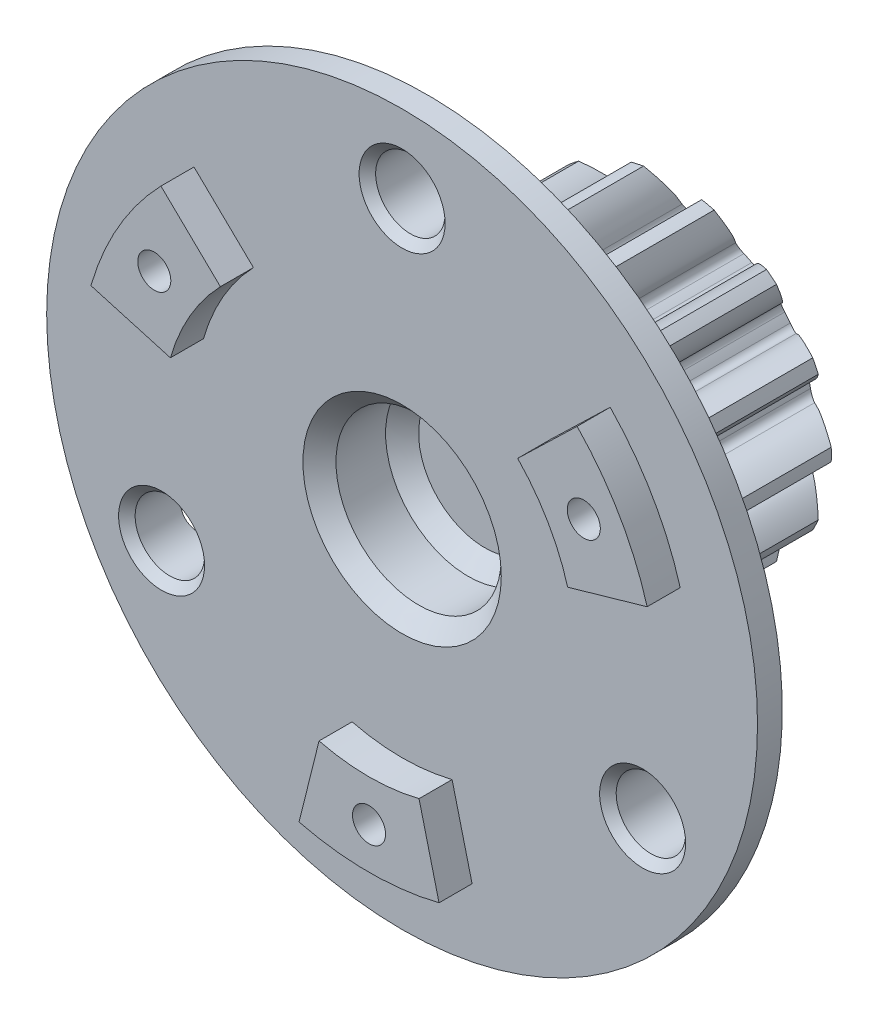
from build123d import *

# Parameters (mm, degrees)
SKETCH1_R                    = 9.6
LASHENA_DEPTH                = 15
CUT_EXTRUDEA_DEPTH           = 15
WWW_KYTOOL_CN_COUNT          = 14
SKETCH3_R                    = 21.5
BOSS_EXTRUDE2_DEPTH          = 3.5
SKETCH4_R                    = 2.1
CUT_EXTRUDE2_DEPTH           = 34.904277187
CHAMFER1_SIZE                = 0.5
CIRPATTERN2_COUNT            = 3
CHAMFER1_OF_CIRPATTERN2_SIZE = 0.5
SKETCH5_R                    = 21.5
SKETCH5_R_2                  = 19.5
CUT_EXTRUDE3_DEPTH           = 2
BOSS_EXTRUDE3_DEPTH          = 2
SKETCH7_R                    = 1
CUT_EXTRUDE4_DEPTH           = 37.670833153
CIRPATTERN3_COUNT            = 3
CHAMFER2_SIZE                = 1
SKETCH9_R                    = 5
CUT_EXTRUDE5_DEPTH           = 5
CHAMFER3_SIZE                = 1
CHAMFER4_SIZE                = 1


with BuildPart() as part:
    # Sketch1 → LaShenA (new body)
    with BuildSketch(Plane.XY):
        Circle(SKETCH1_R)
    extrude(amount=LASHENA_DEPTH)

    # SketchA → Cut-ExtrudeA (cut)
    with BuildSketch(Plane.XY.offset(15)):
        with BuildLine():
            ThreePointArc((0.26393016, 6.894950389), (0, 6.9), (-0.26393016, 6.894950389))
            ThreePointArc((-0.26393016, 6.894950389), (-0.579770413, 7.005805588), (-0.734822357, 7.302458305))
            add(Edge.make_bspline(
                [(-0.734822357, 7.302458305), (-0.754433399, 7.487112064), (-0.737569189, 7.703882298), (-0.781720243, 7.928445907), (-0.797392974, 7.985498549), (-0.811085013, 8.030575138), (-0.828493419, 8.082070174), (-0.849959168, 8.139814633), (-0.875893686, 8.203596808), (-0.906673874, 8.273194995), (-0.942675165, 8.348367366), (-0.984260087, 8.428855678), (-1.031780916, 8.514384646), (-1.085577958, 8.604662703), (-1.145979199, 8.699382364), (-1.213299565, 8.798220744), (-1.287840319, 8.90084006), (-1.369888442, 9.006888177), (-1.459716048, 9.11599916), (-1.557579813, 9.227793861), (-1.663720428, 9.341880521), (-1.778362068, 9.457855399), (-1.90171193, 9.575303407), (-2.033959602, 9.693798799), (-2.226077653, 9.855722018), (-2.3785632, 9.972613701), (-2.48435509, 10.048922054)],
                knots=[0.117633248, 0.117633248, 0.117633248, 0.117633248, 0.261739633, 0.285267442, 0.295625886, 0.307867683, 0.321992833, 0.338001336, 0.355893192, 0.375668402, 0.397326964, 0.42086888, 0.446294149, 0.473602771, 0.502794746, 0.533870075, 0.566828756, 0.601670791, 0.638396179, 0.677004921, 0.717497015, 0.759872463, 0.804131264, 0.850273418, 0.898298926, 1, 1, 1, 1], degree=3))
            ThreePointArc((-2.48435509, 10.048922054), (0, 10.351466304), (2.48435509, 10.048922054))
            add(Edge.make_bspline(
                [(0.734822357, 7.302458305), (0.754433399, 7.487112064), (0.737569189, 7.703882298), (0.781720243, 7.928445907), (0.797392974, 7.985498549), (0.811085013, 8.030575138), (0.828493419, 8.082070174), (0.849959168, 8.139814633), (0.875893686, 8.203596808), (0.906673874, 8.273194995), (0.942675165, 8.348367366), (0.984260087, 8.428855678), (1.031780916, 8.514384646), (1.085577958, 8.604662703), (1.145979199, 8.699382364), (1.213299565, 8.798220744), (1.287840319, 8.90084006), (1.369888442, 9.006888177), (1.459716048, 9.11599916), (1.557579813, 9.227793861), (1.663720428, 9.341880521), (1.778362068, 9.457855399), (1.90171193, 9.575303407), (2.033959602, 9.693798799), (2.226077653, 9.855722018), (2.3785632, 9.972613701), (2.48435509, 10.048922054)],
                knots=[0.117633248, 0.117633248, 0.117633248, 0.117633248, 0.261739633, 0.285267442, 0.295625886, 0.307867683, 0.321992833, 0.338001336, 0.355893192, 0.375668402, 0.397326964, 0.42086888, 0.446294149, 0.473602771, 0.502794746, 0.533870075, 0.566828756, 0.601670791, 0.638396179, 0.677004921, 0.717497015, 0.759872463, 0.804131264, 0.850273418, 0.898298926, 1, 1, 1, 1], degree=3))
            ThreePointArc((0.734822357, 7.302458305), (0.579770413, 7.005805588), (0.26393016, 6.894950389))
        make_face()
    cut_extrudea = extrude(amount=-CUT_EXTRUDEA_DEPTH, mode=Mode.SUBTRACT)

    # www.KYTool.cn: Cut-ExtrudeA ×14 about axis
    www_kytool_cn_axis = Axis((0, 0, -88.99), (0, 0, 1))
    for i in range(1, WWW_KYTOOL_CN_COUNT):
        add(cut_extrudea.rotate(www_kytool_cn_axis, i * 360 / WWW_KYTOOL_CN_COUNT), mode=Mode.SUBTRACT)

    # Sketch3 → Boss-Extrude2 (add)
    with BuildSketch(Plane.XY.offset(15)):
        Circle(SKETCH3_R)
    extrude(amount=BOSS_EXTRUDE2_DEPTH)

    # Sketch4 → Cut-Extrude2 (cut, through all)
    with BuildSketch(Plane(origin=(0, 0, 15), x_dir=(-1, 0, 0), z_dir=(0, 0, -1))):
        with Locations((0, 16.8)):
            Circle(SKETCH4_R)
    cut_extrude2 = extrude(amount=-CUT_EXTRUDE2_DEPTH, mode=Mode.SUBTRACT)

    # Chamfer1
    chamfer1_edges = [part.edges().sort_by_distance(p)[0] for p in [
        (2.1, 16.8, 18.5),
    ]]
    chamfer(chamfer1_edges, length=CHAMFER1_SIZE)

    # CirPattern2: Cut-Extrude2 ×3 about axis
    cirpattern2_axis = Axis((0, 0, 0), (0, 0, 1))
    for i in range(1, CIRPATTERN2_COUNT):
        add(cut_extrude2.rotate(cirpattern2_axis, i * 360 / CIRPATTERN2_COUNT), mode=Mode.SUBTRACT)

    # Chamfer1 of CirPattern2
    chamfer1_of_cirpattern2_edges = [part.edges().sort_by_distance(p)[0] for p in [
        (-15.599226784, -6.581346652, 18.5),
        (13.499226784, -10.218653348, 18.5),
    ]]
    chamfer(chamfer1_of_cirpattern2_edges, length=CHAMFER1_OF_CIRPATTERN2_SIZE)

    # Sketch5 → Cut-Extrude3 (cut)
    with BuildSketch(Plane(origin=(0, 0, 15), x_dir=(-1, 0, 0), z_dir=(0, 0, -1))):
        Circle(SKETCH5_R)
        Circle(SKETCH5_R_2, mode=Mode.SUBTRACT)
    extrude(amount=-CUT_EXTRUDE3_DEPTH, mode=Mode.SUBTRACT)

    # Sketch6 → Boss-Extrude3 (add)
    with BuildSketch(Plane.XY.offset(18.5)):
        with BuildLine():
            Line((0, -12.5), (0, -17.5))
            ThreePointArc((0, -17.5), (2.13271351, -17.369557654), (4.233633173, -16.98017521))
            Line((4.233633173, -16.98017521), (3.024023695, -12.128696578))
            ThreePointArc((3.024023695, -12.128696578), (1.523366793, -12.406826896), (0, -12.5))
        make_face()
        with BuildLine():
            Line((-3.024023695, -12.128696578), (-4.233633173, -16.98017521))
            ThreePointArc((-4.233633173, -16.98017521), (-2.13271351, -17.369557654), (0, -17.5))
            Line((0, -17.5), (0, -12.5))
            ThreePointArc((0, -12.5), (-1.523366793, -12.406826896), (-3.024023695, -12.128696578))
        make_face()
    boss_extrude3 = extrude(amount=BOSS_EXTRUDE3_DEPTH)

    # Sketch7 → Cut-Extrude4 (cut, through all)
    with BuildSketch(Plane.XY.offset(20.5)):
        with Locations((0, -15)):
            Circle(SKETCH7_R)
    cut_extrude4 = extrude(amount=-CUT_EXTRUDE4_DEPTH, mode=Mode.SUBTRACT)

    # CirPattern3: Boss-Extrude3, Cut-Extrude4 ×3 about axis
    cirpattern3_axis = Axis((0, 0, 0), (0, 0, 1))
    add([boss_extrude3.rotate(cirpattern3_axis, i * 360 / CIRPATTERN3_COUNT) for i in range(1, CIRPATTERN3_COUNT)])
    add([cut_extrude4.rotate(cirpattern3_axis, i * 360 / CIRPATTERN3_COUNT) for i in range(1, CIRPATTERN3_COUNT)], mode=Mode.SUBTRACT)

    # Chamfer2
    chamfer2_edges = [part.edges().sort_by_distance(p)[0] for p in [
        (-1, -15, 15),
        (13.490381057, 6.633974596, 15),
        (-12.490381057, 8.366025404, 15),
    ]]
    chamfer(chamfer2_edges, length=CHAMFER2_SIZE)

    # Sketch8 → Cut-Revolve1 (revolve, cut)
    with BuildSketch(Plane(origin=(0, 0, 0), x_dir=(1, 0, 0), z_dir=(0, 1, 0))):
        Polygon((-9.6, 0), (-9.6, -2.136195996), (-5.9, 0), align=None)
    revolve(axis=Axis((0, 0, 0), (0, 0, -1)), mode=Mode.SUBTRACT)

    # Sketch9 → Cut-Extrude5 (cut)
    with BuildSketch(Plane.XY.offset(18.5)):
        Circle(SKETCH9_R)
    extrude(amount=-CUT_EXTRUDE5_DEPTH, mode=Mode.SUBTRACT)

    # Chamfer3
    chamfer3_edges = [part.edges().sort_by_distance(p)[0] for p in [
        (-5, 0, 13.5),
        (-5, 0, 18.5),
    ]]
    chamfer(chamfer3_edges, length=CHAMFER3_SIZE)

    # Chamfer4
    # the kernel refuses this chamfer: 1 mm, written as the material it takes off along each edge
    with BuildSketch(Plane(origin=(0, 0, 15), x_dir=(-1, 0, 0), z_dir=(0, -1, 0))) as chamfer4_piece_1:
        Polygon((19.5, -CHAMFER4_SIZE), (19.5 - CHAMFER4_SIZE, 0), (19.5, 0), align=None)
    revolve(axis=Axis((0, 0, 15), (0, 0, -1)), mode=Mode.SUBTRACT)


solid = part.part
